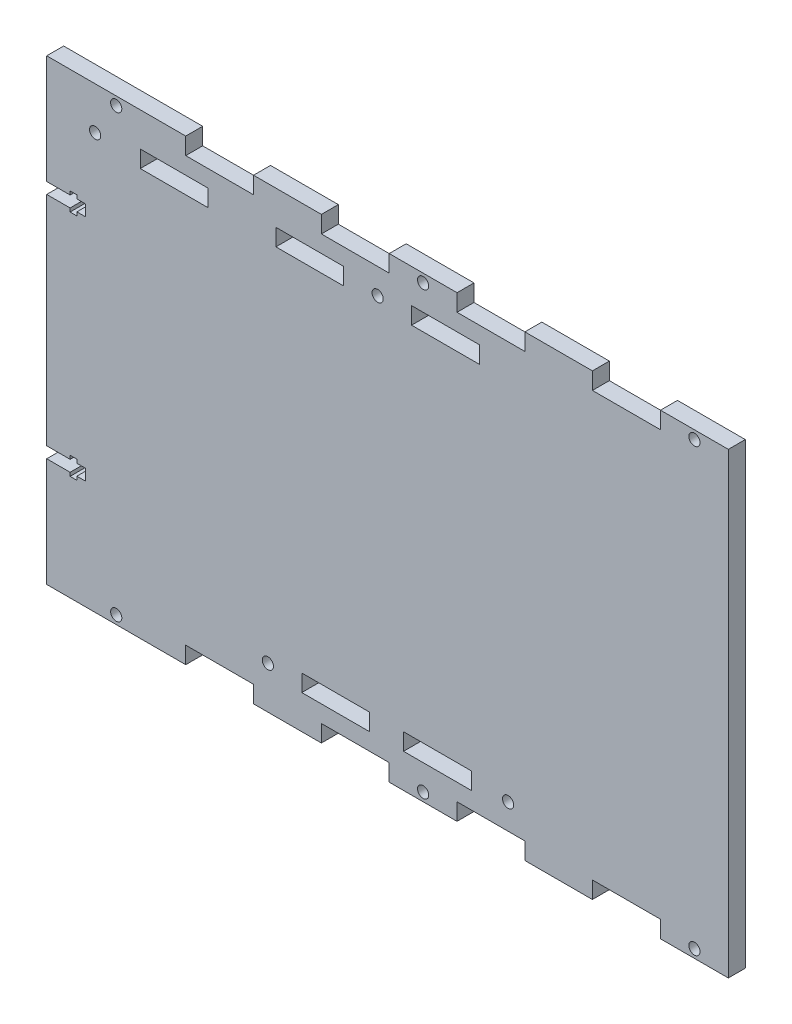
from build123d import *

# Parameters (mm, degrees)
SKETCH1_W           = 255.259874896
SKETCH1_H           = 171.45
BOSS_EXTRUDE1_DEPTH = 6.35
SKETCH8_W           = 25.509821582
SKETCH8_H           = 6.35
SKETCH8_W_2         = 25.4
CUT_EXTRUDE5_DEPTH  = 209.955242778
SKETCH11_R          = 2.0955
CUT_EXTRUDE7_DEPTH  = 209.955242778
SKETCH12_W          = 25.4
SKETCH12_H          = 6.35
CUT_EXTRUDE8_DEPTH  = 209.955242778
SKETCH13_W          = 25.396028295
SKETCH13_H          = 6.35
SKETCH13_W_2        = 25.4
CUT_EXTRUDE9_DEPTH  = 209.955242778
SKETCH14_R          = 2.0955
CUT_EXTRUDE10_DEPTH = 209.955242778


with BuildPart() as part:
    # Sketch1 → Boss-Extrude1 (new body)
    with BuildSketch(Plane.XY):
        with Locations((-11.719947229, 69.85)):
            Rectangle(SKETCH1_W, SKETCH1_H)
    extrude(amount=BOSS_EXTRUDE1_DEPTH)

    # Sketch8 → Cut-Extrude5 (cut, through all)
    with BuildSketch(Plane(origin=(0, 0, 0), x_dir=(-1, 0, 0), z_dir=(0, 0, -1))):
        with Locations((-77.755079428, -12.7)):
            Rectangle(SKETCH8_W, SKETCH8_H)
        with Locations((-27.009990219, -12.7)):
            Rectangle(SKETCH8_W_2, SKETCH8_H)
        with Locations((23.790009781, -12.7)):
            Rectangle(SKETCH8_W_2, SKETCH8_H)
        with Locations((74.590009781, -12.7)):
            Rectangle(SKETCH8_W_2, SKETCH8_H)
        with Locations((-77.755079428, 152.4)):
            Rectangle(SKETCH8_W, SKETCH8_H)
        with Locations((-27.009990219, 152.4)):
            Rectangle(SKETCH8_W_2, SKETCH8_H)
        with Locations((23.790009781, 152.4)):
            Rectangle(SKETCH8_W_2, SKETCH8_H)
        with Locations((74.590009781, 152.4)):
            Rectangle(SKETCH8_W_2, SKETCH8_H)
    extrude(amount=-CUT_EXTRUDE5_DEPTH, mode=Mode.SUBTRACT)

    # Sketch11 → Cut-Extrude7 (cut, through all)
    with BuildSketch(Plane.XY.offset(6.35)):
        with Locations((103.209990219, -12.7)):
            Circle(SKETCH11_R)
        with Locations((1.609990219, -12.7)):
            Circle(SKETCH11_R)
        with Locations((-113.319947229, -12.7)):
            Circle(SKETCH11_R)
        with Locations((103.209990219, 152.4)):
            Circle(SKETCH11_R)
        with Locations((1.609990219, 152.4)):
            Circle(SKETCH11_R)
        with Locations((-113.319947229, 152.4)):
            Circle(SKETCH11_R)
    extrude(amount=-CUT_EXTRUDE7_DEPTH, mode=Mode.SUBTRACT)

    # Sketch12 → Cut-Extrude8 (cut, through all)
    with BuildSketch(Plane.XY.offset(6.35)):
        with Locations((-31.130968827, 0)):
            Rectangle(SKETCH12_W, SKETCH12_H)
        with Locations((6.969031173, 0)):
            Rectangle(SKETCH12_W, SKETCH12_H)
    extrude(amount=-CUT_EXTRUDE8_DEPTH, mode=Mode.SUBTRACT)

    # Sketch13 → Cut-Extrude9 (cut, through all)
    with BuildSketch(Plane.XY.offset(6.35)):
        with Locations((-91.615379981, 139.7)):
            Rectangle(SKETCH13_W, SKETCH13_H)
        with Locations((-40.813394128, 139.7)):
            Rectangle(SKETCH13_W_2, SKETCH13_H)
        with Locations((9.986605872, 139.7)):
            Rectangle(SKETCH13_W_2, SKETCH13_H)
    extrude(amount=-CUT_EXTRUDE9_DEPTH, mode=Mode.SUBTRACT)

    # Sketch14 → Cut-Extrude10 (cut, through all)
    with BuildSketch(Plane(origin=(0, 0, 0), x_dir=(-1, 0, 0), z_dir=(0, 0, -1))):
        with Locations((-33.425849507, 0)):
            Circle(SKETCH14_R)
        with Locations((56.530968827, 0)):
            Circle(SKETCH14_R)
        with Locations((121.212053574, 139.7)):
            Circle(SKETCH14_R)
        with Locations((15.413394128, 139.7)):
            Circle(SKETCH14_R)
        Polygon((139.349884677, 24.892), (139.349884677, 29.083), (130.586884677, 29.083), (130.586884677, 30.4165), (128.046884677, 30.4165), (128.046884677, 29.083), (124.744884677, 29.083), (124.744884677, 24.892), (128.046884677, 24.892), (128.046884677, 23.5585), (130.586884677, 23.5585), (130.586884677, 24.892), align=None)
        Polygon((139.349884677, 110.617), (139.349884677, 114.808), (130.586884677, 114.808), (130.586884677, 116.1415), (128.046884677, 116.1415), (128.046884677, 114.808), (124.744884677, 114.808), (124.744884677, 110.617), (128.046884677, 110.617), (128.046884677, 109.2835), (130.586884677, 109.2835), (130.586884677, 110.617), align=None)
    extrude(amount=-CUT_EXTRUDE10_DEPTH, mode=Mode.SUBTRACT)


solid = part.part
